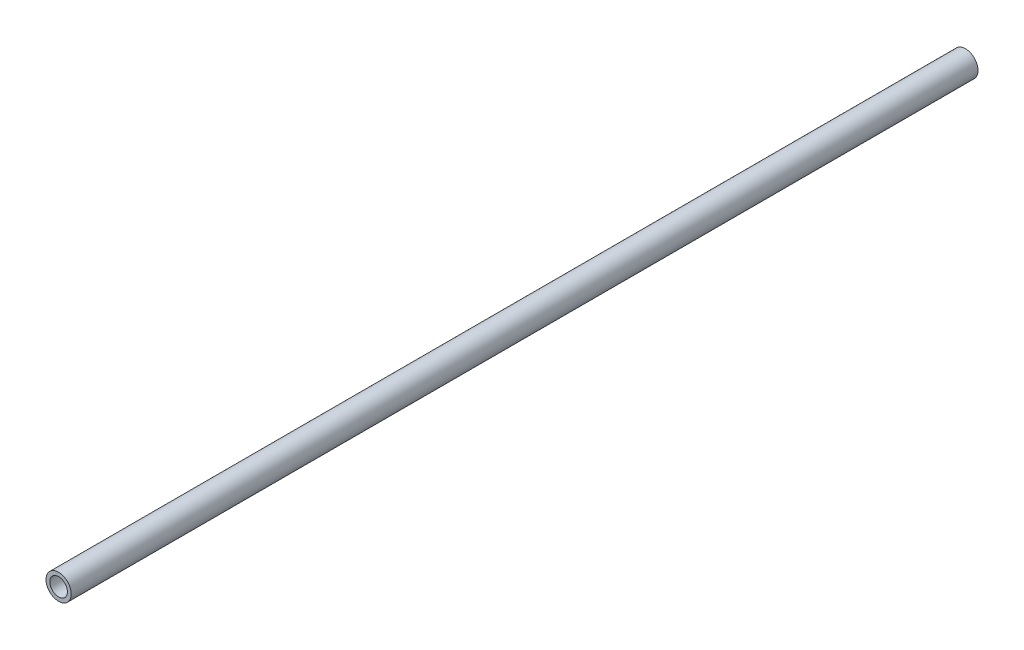
from build123d import *

# Parameters (mm, degrees)
SKETCH1_R           = 10
SKETCH1_R_2         = 7
BOSS_EXTRUDE1_DEPTH = 720


with BuildPart() as part:
    # Sketch1 → Boss-Extrude1 (new body)
    with BuildSketch(Plane.XY):
        Circle(SKETCH1_R)
        Circle(SKETCH1_R_2, mode=Mode.SUBTRACT)
    extrude(amount=BOSS_EXTRUDE1_DEPTH)


solid = part.part
